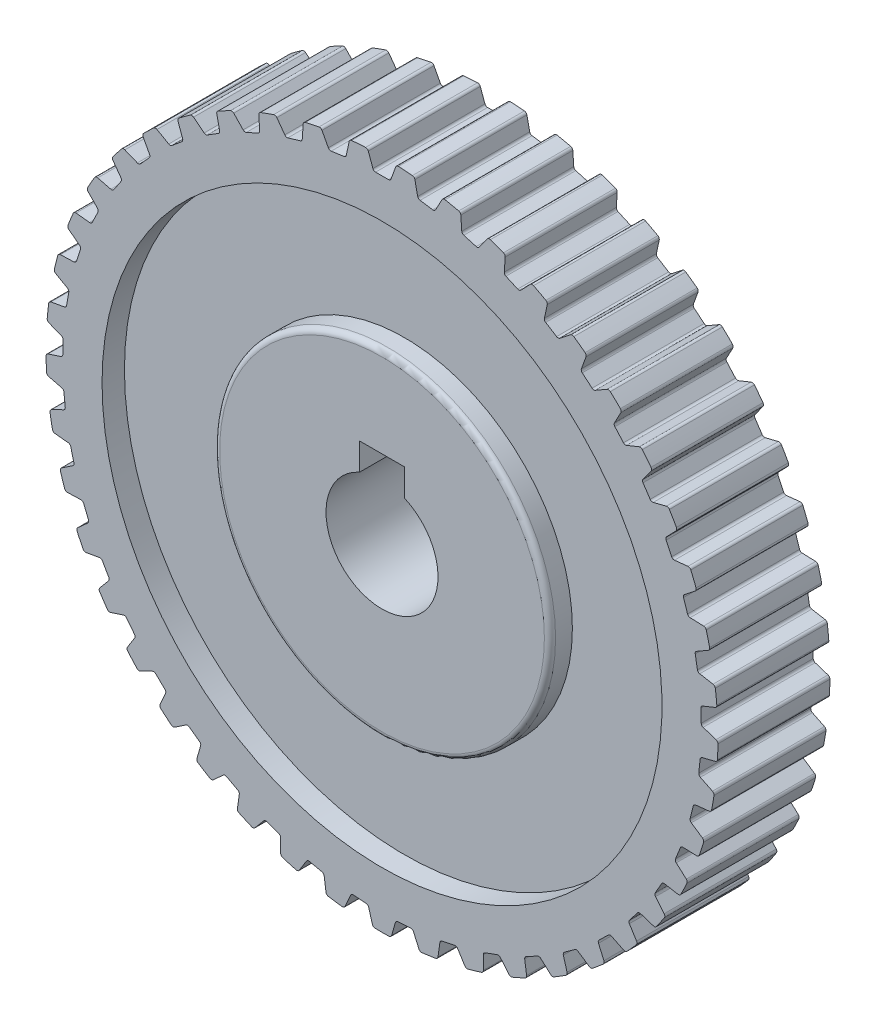
from build123d import *

# Parameters (mm, degrees)
SKETCH1_R           = 30
BOSS_EXTRUDE1_DEPTH = 5
CUT_EXTRUDE3_DEPTH  = 44.588989435
CIRPATTERN2_COUNT   = 45
SKETCH3_R           = 25
SKETCH3_R_2         = 15
CUT_EXTRUDE4_DEPTH  = 2
FILLET1_R           = 0.5
FILLET2_R           = 0.25


with BuildPart() as part:
    # Sketch1 → Boss-Extrude1 (new, symmetric)
    with BuildSketch(Plane.XY):
        Circle(SKETCH1_R)
        with BuildLine():
            Line((-2, 7), (2, 7))
            Line((2, 7), (2, 4.582575695))
            ThreePointArc((2, 4.582575695), (0, -5), (-2, 4.582575695))
            Line((-2, 4.582575695), (-2, 7))
        make_face(mode=Mode.SUBTRACT)
    extrude(amount=BOSS_EXTRUDE1_DEPTH, both=True)

    # Sketch2 → Cut-Extrude3 (cut, through all)
    with BuildSketch(Plane.XY.offset(5)):
        with BuildLine():
            Line((-0.75, 28.5), (0.75, 28.5))
            Line((0.75, 28.5), (1.285919783, 29.972427501))
            ThreePointArc((1.285919783, 29.972427501), (0, 30.700151441), (-1.285919783, 29.972427501))
            Line((-1.285919783, 29.972427501), (-0.75, 28.5))
        make_face()
    cut_extrude3 = extrude(amount=-CUT_EXTRUDE3_DEPTH, mode=Mode.SUBTRACT)

    # CirPattern2: Cut-Extrude3 ×45 about axis
    cirpattern2_axis = Axis((0, 0, 5), (0, 0, 1))
    for i in range(1, CIRPATTERN2_COUNT):
        add(cut_extrude3.rotate(cirpattern2_axis, i * 360 / CIRPATTERN2_COUNT), mode=Mode.SUBTRACT)

    # Sketch3 → Cut-Extrude4 (cut)
    with BuildSketch(Plane(origin=(0, 0, -5), x_dir=(-1, 0, 0), z_dir=(0, 0, -1))):
        Circle(SKETCH3_R)
        Circle(SKETCH3_R_2, mode=Mode.SUBTRACT)
    cut_extrude4 = extrude(amount=-CUT_EXTRUDE4_DEPTH, mode=Mode.SUBTRACT)

    # Mirror1: Cut-Extrude4 across plane
    add(cut_extrude4.mirror(Plane.XY), mode=Mode.SUBTRACT)

    # Fillet1
    fillet1_edges = [part.edges().sort_by_distance(p)[0] for p in [
        (15, 0, -5),
        (15, 0, 5),
    ]]
    fillet(fillet1_edges, radius=FILLET1_R)

    # Fillet2
    fillet2_edges = [part.edges().sort_by_distance(p)[0] for p in [
        (28.422270365, -2.233169782, 0),
        (29.942650626, -1.854096408, 0),
        (29.999047061, -0.2391138, 0),
        (28.508813193, 0.245092536, 0),
        (28.456463948, 1.744178776, 0),
        (29.909291155, 2.33115907, 0),
        (29.740376607, 3.938273644, 0),
        (28.197257094, 4.210367249, 0),
        (27.936784828, 5.687578878, 0),
        (29.293781353, 6.471041187, 0),
        (28.90284355, 8.039007072, 0),
        (27.33687346, 8.093691952, 0),
        (26.873347969, 9.520276727, 0),
        (28.108101418, 10.484971849, 0),
        (27.502749521, 11.983270371, 0),
        (25.94440868, 11.819482149, 0),
        (25.286851959, 13.167673218, 0),
        (25.567345756, 15.694292943, 0),
        (24.046965495, 15.31521957, 0),
        (23.20817614, 16.558775928, 0),
        (24.129191322, 17.826444573, 0),
        (23.134302688, 19.099843956, 0),
        (21.681475481, 18.512863662, 0),
        (20.677779571, 19.6275809, 0),
        (21.413406121, 21.01109322, 0),
        (20.250976734, 22.133638231, 0),
        (18.893980208, 21.350175922, 0),
        (17.744913544, 22.314357336, 0),
        (18.280833326, 23.786784837, 0),
        (16.973488552, 24.736626415, 0),
        (15.738735103, 23.771931292, 0),
        (14.466662959, 24.566810189, 0),
        (14.792444905, 26.099493745, 0),
        (13.365630723, 26.858144303, 0),
        (12.277153421, 25.730993061, 0),
        (10.906835234, 26.341098025, 0),
        (11.01613837, 27.904205694, 0),
        (9.497626095, 28.456898963, 0),
        (8.576610913, 27.189230317, 0),
        (7.134718369, 27.602686351, 0),
        (7.025415233, 29.16579402, 0),
        (5.444760978, 29.501772453, 0),
        (4.709134429, 28.118260133, 0),
        (3.223732326, 28.327019785, 0),
        (2.897950379, 29.859703341, 0),
        (1.285919783, 29.972427501, 0),
        (0.75, 28.5, 0),
        (-0.75, 28.5, 0),
        (-1.285919783, 29.972427501, 0),
        (-2.897950379, 29.859703341, 0),
        (-3.223732326, 28.327019785, 0),
        (-4.709134429, 28.118260133, 0),
        (-5.444760978, 29.501772453, 0),
        (-7.025415233, 29.16579402, 0),
        (-7.134718369, 27.602686351, 0),
        (-8.576610913, 27.189230317, 0),
        (-9.497626095, 28.456898963, 0),
        (-11.01613837, 27.904205694, 0),
        (-10.906835234, 26.341098025, 0),
        (-12.277153421, 25.730993061, 0),
        (-13.365630723, 26.858144303, 0),
        (-14.792444905, 26.099493745, 0),
        (-14.466662959, 24.566810189, 0),
        (-15.738735103, 23.771931292, 0),
        (-16.973488552, 24.736626415, 0),
        (-18.280833326, 23.786784837, 0),
        (-17.744913544, 22.314357336, 0),
        (-18.893980208, 21.350175922, 0),
        (-20.250976734, 22.133638231, 0),
        (-21.413406121, 21.01109322, 0),
        (-20.677779571, 19.6275809, 0),
        (-21.681475481, 18.512863662, 0),
        (-23.134302688, 19.099843956, 0),
        (-24.129191322, 17.826444573, 0),
        (-23.20817614, 16.558775928, 0),
        (-24.046965495, 15.31521957, 0),
        (-25.567345756, 15.694292943, 0),
        (-26.375329261, 14.29482446, 0),
        (-25.286851959, 13.167673218, 0),
        (-25.94440868, 11.819482149, 0),
        (-27.502749521, 11.983270371, 0),
        (-28.108101418, 10.484971849, 0),
        (-26.873347969, 9.520276727, 0),
        (-27.33687346, 8.093691952, 0),
        (-28.90284355, 8.039007072, 0),
        (-29.293781353, 6.471041187, 0),
        (-27.936784828, 5.687578878, 0),
        (-28.197257094, 4.210367249, 0),
        (-29.740376607, 3.938273644, 0),
        (-29.909291155, 2.33115907, 0),
        (-28.456463948, 1.744178776, 0),
        (-28.508813193, 0.245092536, 0),
        (-29.999047061, -0.2391138, 0),
        (-29.942650626, -1.854096408, 0),
        (-28.422270365, -2.233169782, 0),
        (-28.265477671, -3.724952625, 0),
        (-29.673820188, -4.411847167, 0),
        (-29.393210462, -6.003264007, 0),
        (-27.834869621, -6.16705223, 0),
        (-27.471986777, -7.622495819, 0),
        (-28.771026159, -8.498708946, 0),
        (-28.27166489, -10.035584902, 0),
        (-26.7056948, -9.980900021, 0),
        (-26.14378491, -11.371675803, 0),
        (-27.308236832, -12.420153023, 0),
        (-26.59984352, -13.872574552, 0),
        (-25.056724008, -13.600480947, 0),
        (-24.306724008, -14.899519053, 0),
        (-25.313923738, -16.099852949, 0),
        (-24.410286453, -17.439550318, 0),
        (-22.920052584, -16.955343982, 0),
        (-21.996560371, -18.137360112, 0),
        (-22.826903912, -19.466187551, 0),
        (-21.745610926, -20.667085074, 0),
        (-20.337268408, -19.980190532, 0),
        (-19.258258708, -21.022178087, 0),
        (-19.895584367, -22.453634955, 0),
        (-18.657681818, -23.492358527, 0),
        (-17.358642436, -22.6161454, 0),
        (-16.145116945, -23.497823279, 0),
        (-16.577019903, -25.004047895, 0),
        (-15.206602156, -25.860379944, 0),
        (-14.042150234, -24.811902724, 0),
        (-12.717728845, -25.516110069, 0),
        (-12.935802603, -27.067785484, 0),
        (-11.45954328, -27.725058482, 0),
        (-10.45234355, -26.524724585, 0),
        (-9.042804619, -27.0377548, 0),
        (-9.042804619, -28.604679418, 0),
        (-7.48943743, -29.050100292, 0),
        (-6.659093889, -27.721272853, 0),
        (-5.191872488, -28.033140389, 0),
        (-4.97379873, -29.584815805, 0),
        (-3.373558199, -29.809714945, 0),
        (-2.736232539, -28.378258077, 0),
        (-1.239886464, -28.482892788, 0),
        (-0.807983505, -29.989117404, 0),
        (0.807983505, -29.989117404, 0),
        (1.239886464, -28.482892788, 0),
        (2.736232539, -28.378258077, 0),
        (3.373558199, -29.809714945, 0),
        (4.97379873, -29.584815805, 0),
        (5.191872488, -28.033140389, 0),
        (6.659093889, -27.721272853, 0),
        (7.48943743, -29.050100292, 0),
        (9.042804619, -28.604679418, 0),
        (9.042804619, -27.0377548, 0),
        (10.45234355, -26.524724585, 0),
        (11.45954328, -27.725058482, 0),
        (12.935802603, -27.067785484, 0),
        (12.717728845, -25.516110069, 0),
        (14.042150234, -24.811902724, 0),
        (15.206602156, -25.860379944, 0),
        (16.577019903, -25.004047895, 0),
        (16.145116945, -23.497823279, 0),
        (17.358642436, -22.6161454, 0),
        (18.657681818, -23.492358527, 0),
        (19.895584367, -22.453634955, 0),
        (19.258258708, -21.022178087, 0),
        (20.337268408, -19.980190532, 0),
        (21.745610926, -20.667085074, 0),
        (22.826903912, -19.466187551, 0),
        (21.996560371, -18.137360112, 0),
        (22.920052584, -16.955343982, 0),
        (24.410286453, -17.439550318, 0),
        (25.313923738, -16.099852949, 0),
        (24.306724008, -14.899519053, 0),
        (25.056724008, -13.600480947, 0),
        (26.59984352, -13.872574552, 0),
        (27.308236832, -12.420153023, 0),
        (26.14378491, -11.371675803, 0),
        (26.7056948, -9.980900021, 0),
        (28.27166489, -10.035584902, 0),
        (28.771026159, -8.498708946, 0),
        (27.471986777, -7.622495819, 0),
        (27.834869621, -6.16705223, 0),
        (29.393210462, -6.003264007, 0),
        (29.673820188, -4.411847167, 0),
        (28.265477671, -3.724952625, 0),
        (26.375329261, 14.29482446, 0),
    ]]
    fillet(fillet2_edges, radius=FILLET2_R)


solid = part.part
